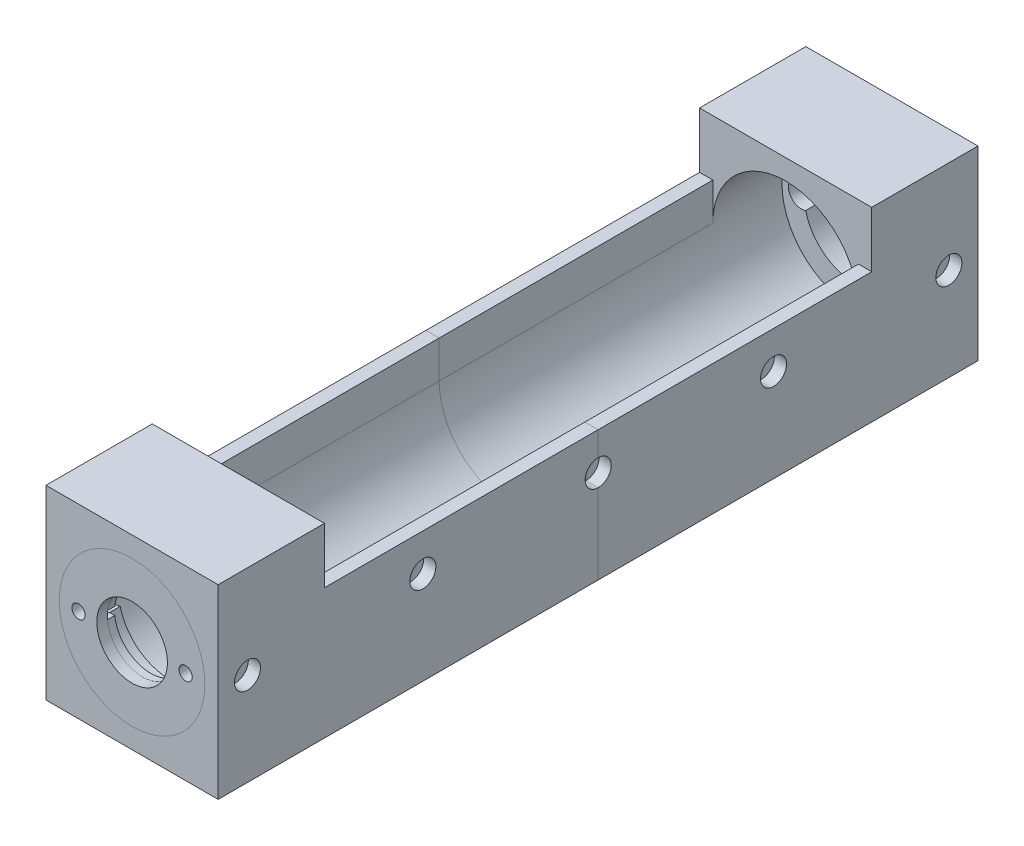
from build123d import *
from build123d.topology import SkipClean

# Parameters (mm, degrees)
CROQUIS1_R              = 13.7
SALIENTE_EXTRUIR1_DEPTH = 5
CROQUIS2_R              = 9.5
CORTAR_EXTRUIR1_DEPTH   = 3.5
CROQUIS3_R              = 6.8
CORTAR_EXTRUIR2_DEPTH   = 3
SALIENTE_EXTRUIR2_START = 2
CROQUIS4_R              = 13.7
CROQUIS4_R_2            = 6.65
SALIENTE_EXTRUIR2_DEPTH = 2
CROQUIS5_R              = 1.25
CORTAR_EXTRUIR3_DEPTH   = 21.600485431
CROQUIS6_W              = 32.4
CROQUIS6_H              = 35
CROQUIS6_R              = 13.7
SALIENTE_EXTRUIR3_DEPTH = 20
SALIENTE_EXTRUIR5_DEPTH = 51.5
CROQUIS9_R              = 2.45
CORTAR_EXTRUIR4_DEPTH   = 2.3


with BuildPart() as part:
    # Croquis1 → Saliente-Extruir1 (new body)
    with BuildSketch(Plane.XY):
        Circle(CROQUIS1_R)
        with BuildLine():
            Line((0, 0.75), (7.800197377, 0.75))
            ThreePointArc((7.800197377, 0.75), (10.459785271, 2.369760146), (12.48, 0))
            ThreePointArc((12.48, 0), (10.459785271, -2.369760146), (7.800197377, -0.75))
            Line((7.800197377, -0.75), (0, -0.75))
            Line((0, -0.75), (-7.800197377, -0.75))
            ThreePointArc((-7.800197377, -0.75), (-12.48, 0), (-7.800197377, 0.75))
            Line((-7.800197377, 0.75), (0, 0.75))
        make_face(mode=Mode.SUBTRACT)
    extrude(amount=SALIENTE_EXTRUIR1_DEPTH)

    # Croquis2 → Cortar-Extruir1 (cut)
    with BuildSketch(Plane.XY.offset(5)):
        Circle(CROQUIS2_R)
    extrude(amount=-CORTAR_EXTRUIR1_DEPTH, mode=Mode.SUBTRACT)

    # Croquis3 → Cortar-Extruir2 (cut)
    with BuildSketch(Plane.XY.offset(1.5)):
        Circle(CROQUIS3_R)
    extrude(amount=-CORTAR_EXTRUIR2_DEPTH, mode=Mode.SUBTRACT)

    # Croquis4 → Saliente-Extruir2 (add)
    with BuildSketch(Plane(origin=(0, 0, 0), x_dir=(-1, 0, 0), z_dir=(0, 0, -1)).offset(SALIENTE_EXTRUIR2_START)):
        Circle(CROQUIS4_R)
        Circle(CROQUIS4_R_2, mode=Mode.SUBTRACT)
    extrude(amount=-SALIENTE_EXTRUIR2_DEPTH)

    # Croquis5 → Cortar-Extruir3 (cut, through all)
    with BuildSketch(Plane.XY.offset(5)):
        with Locations((-10.08, 0)):
            Circle(CROQUIS5_R)
        with Locations((10.08, 0)):
            Circle(CROQUIS5_R)
    extrude(amount=-CORTAR_EXTRUIR3_DEPTH, mode=Mode.SUBTRACT)


with BuildPart() as body_2:
    # Croquis6 → Saliente-Extruir3 (new body)
    with BuildSketch(Plane(origin=(0, 0, -2), x_dir=(-1, 0, 0), z_dir=(0, 0, -1))):
        Rectangle(CROQUIS6_W, CROQUIS6_H)
        Circle(CROQUIS6_R, mode=Mode.SUBTRACT)
    extrude(amount=-SALIENTE_EXTRUIR3_DEPTH)

    # Croquis8 → Saliente-Extruir5 (add)
    with BuildSketch(Plane.XY.offset(18)):
        with BuildLine():
            Line((-16.2, 7), (-16.2, -17.5))
            Line((-16.2, -17.5), (16.2, -17.5))
            Line((16.2, -17.5), (16.2, 7))
            Line((16.2, 7), (13.7, 7))
            Line((13.7, 7), (13.7, 0))
            ThreePointArc((13.7, 0), (0, -13.7), (-13.7, 0))
            Line((-13.7, 0), (-13.7, 7))
            Line((-13.7, 7), (-16.2, 7))
        make_face()
    extrude(amount=SALIENTE_EXTRUIR5_DEPTH)


with BuildPart() as body_3:
    # Simetría10: mirrored copy
    add(part.part.mirror(Plane.XY.offset(69.5)))


with BuildPart() as body_4:
    # Simetr_a10 2: mirrored copy
    add(body_2.part.mirror(Plane.XY.offset(69.5)))


with BuildPart() as cortar_extruir4_tool:
    # Croquis9 → Cortar-Extruir4 (new body)
    with SkipClean():  # the faces are left unmerged after this step: merging them gives an invalid solid
        with BuildSketch(Plane.ZY.offset(16.2)):
            with Locations((3.479126344, 0)):
                Circle(CROQUIS9_R)
            with Locations((36.479126344, 0)):
                Circle(CROQUIS9_R)
            with Locations((69.479126344, 0)):
                Circle(CROQUIS9_R)
            with Locations((102.479126344, 0)):
                Circle(CROQUIS9_R)
            with Locations((135.479126344, 0)):
                Circle(CROQUIS9_R)
        cortar_extruir4 = extrude(amount=-CORTAR_EXTRUIR4_DEPTH)


with BuildPart() as body_2_1:
    with SkipClean():  # the faces are left unmerged after this step: merging them gives an invalid solid
        add(body_2.part)

        # Cortar-Extruir4: cut by cortar_extruir4_tool
        add(cortar_extruir4_tool.part, mode=Mode.SUBTRACT)


with BuildPart() as body_4_1:
    with SkipClean():  # the faces are left unmerged after this step: merging them gives an invalid solid
        add(body_4.part)

        # Cortar-Extruir4: cut by cortar_extruir4_tool
        add(cortar_extruir4_tool.part, mode=Mode.SUBTRACT)


with BuildPart() as simetr_a11_tool:
    # Simetría11: Cortar-Extruir4 across plane
    with SkipClean():  # the faces are left unmerged after this step: merging them gives an invalid solid
        add(cortar_extruir4.mirror(Plane(origin=(0, 0, 0), x_dir=(0, 0, 1), z_dir=(1, 0, 0))))


with BuildPart() as body_2_2:
    with SkipClean():  # the faces are left unmerged after this step: merging them gives an invalid solid
        add(body_2_1.part)

        # Simetría11: cut by simetr_a11_tool
        add(simetr_a11_tool.part, mode=Mode.SUBTRACT)


with BuildPart() as body_4_2:
    with SkipClean():  # the faces are left unmerged after this step: merging them gives an invalid solid
        add(body_4_1.part)

        # Simetría11: cut by simetr_a11_tool
        add(simetr_a11_tool.part, mode=Mode.SUBTRACT)


solid = Compound([part.part, body_3.part, body_2_2.part, body_4_2.part])
